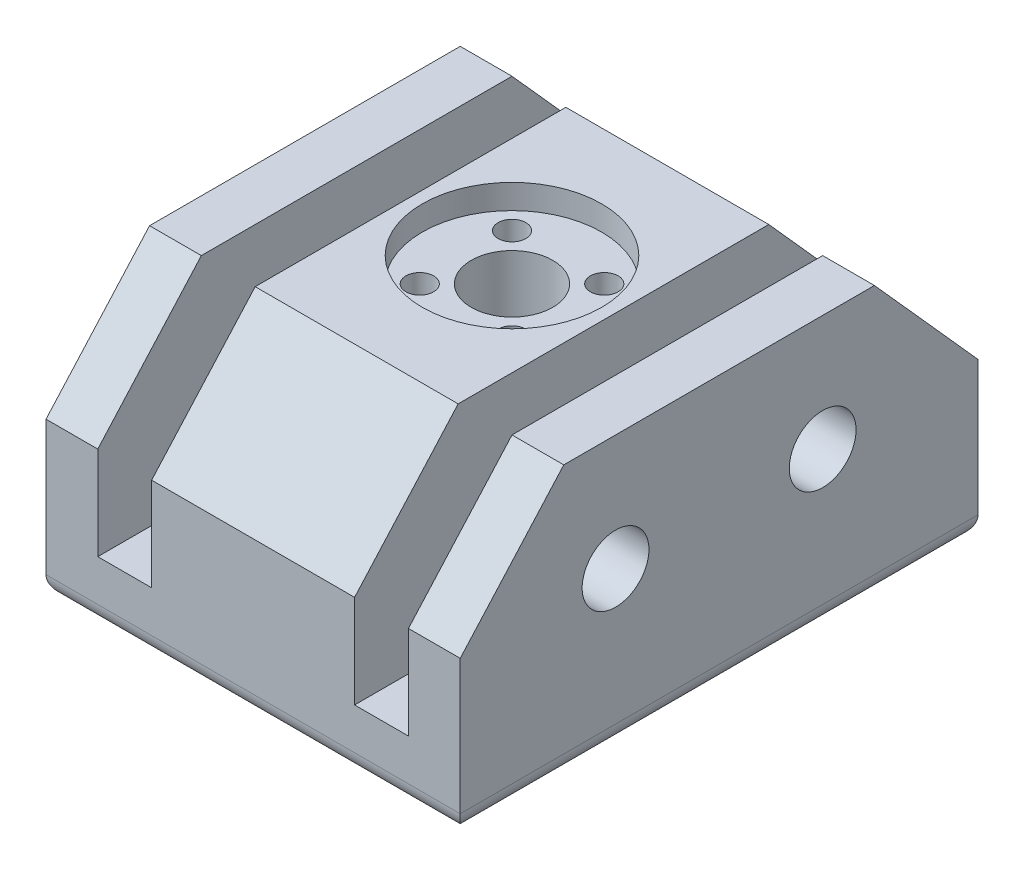
from build123d import *

# Parameters (mm, degrees)
SKETCH1_W           = 63.5
SKETCH1_H           = 6.35
BOSS_EXTRUDE1_DEPTH = 50.8
BOSS_EXTRUDE2_DEPTH = 50.8
SKETCH10_W          = 6.604
SKETCH10_H          = 25.629031657
CUT_EXTRUDE1_DEPTH  = 88.854357354
LPATTERN3_COUNT     = 2
LPATTERN3_PITCH     = 31.496
SKETCH11_R          = 4.09575
CUT_EXTRUDE2_DEPTH  = 88.854357354
FILLET1_R           = 2.54
CUT_EXTRUDE7_REACH  = 89.854
SKETCH21_R          = 1.700000029
SKETCH22_R          = 11
CUT_EXTRUDE8_DEPTH  = 3
SKETCH24_R          = 5
CUT_EXTRUDE10_DEPTH = 88.854357354
SKETCH28_R          = 3.125
CUT_EXTRUDE11_DEPTH = 5


with BuildPart() as part:
    # Sketch1 → Boss-Extrude1 (new body)
    with BuildSketch(Plane(origin=(0, 0, 0), x_dir=(0, 0, -1), z_dir=(1, 0, 0))):
        with Locations((31.75, 3.175)):
            Rectangle(SKETCH1_W, SKETCH1_H)
    extrude(amount=-BOSS_EXTRUDE1_DEPTH)

    # Sketch2 → Boss-Extrude2 (add)
    with BuildSketch(Plane(origin=(0, 0, 0), x_dir=(0, 0, -1), z_dir=(1, 0, 0))):
        Polygon((0, 6.35), (0, 19.05), (12.7, 33.249031657), (50.8, 33.249031657), (63.5, 19.05), (63.5, 6.35), align=None)
    extrude(amount=-BOSS_EXTRUDE2_DEPTH)

    # Sketch10 → Cut-Extrude1 (cut, through all)
    with BuildSketch(Plane(origin=(0, 0, -63.5), x_dir=(-1, 0, 0), z_dir=(0, 0, -1))):
        with Locations((9.652, 20.434515829)):
            Rectangle(SKETCH10_W, SKETCH10_H)
    cut_extrude1 = extrude(amount=-CUT_EXTRUDE1_DEPTH, mode=Mode.SUBTRACT)

    # LPattern3: Cut-Extrude1 ×2
    with Locations(*[(-i * LPATTERN3_PITCH, 0, 0) for i in range(1, LPATTERN3_COUNT)]):
        add(cut_extrude1, mode=Mode.SUBTRACT)

    # Sketch11 → Cut-Extrude2 (cut, through all)
    with BuildSketch(Plane(origin=(0, 0, 0), x_dir=(0, 0, -1), z_dir=(1, 0, 0))):
        with Locations((19.05, 19.05)):
            Circle(SKETCH11_R)
        with Locations((44.45, 19.05)):
            Circle(SKETCH11_R)
    extrude(amount=-CUT_EXTRUDE2_DEPTH, mode=Mode.SUBTRACT)

    # Fillet1
    fillet1_edges = [part.edges().sort_by_distance(p)[0] for p in [
        (0, 0, -31.75),
        (-50.8, 0, -31.75),
        (-25.4, 0, 0),
        (-25.4, 0, -63.5),
    ]]
    fillet(fillet1_edges, radius=FILLET1_R)

    # Sketch21 → Cut-Extrude7 (cut, up to next)
    with BuildSketch(Plane.XZ, mode=Mode.PRIVATE) as cut_extrude7_sk1:
        with Locations((-31.056854284, -37.406854215)):
            Circle(SKETCH21_R)
    cut_extrude7_tool1 = extrude(cut_extrude7_sk1.sketch, amount=-CUT_EXTRUDE7_REACH, mode=Mode.PRIVATE) & part.part
    # Sketch21 → Cut-Extrude7 (cut, up to next)
    with BuildSketch(Plane.XZ, mode=Mode.PRIVATE) as cut_extrude7_sk2:
        with Locations((-31.056854215, -26.093145716)):
            Circle(SKETCH21_R)
    cut_extrude7_tool2 = extrude(cut_extrude7_sk2.sketch, amount=-CUT_EXTRUDE7_REACH, mode=Mode.PRIVATE) & part.part
    # Sketch21 → Cut-Extrude7 (cut, up to next)
    with BuildSketch(Plane.XZ, mode=Mode.PRIVATE) as cut_extrude7_sk3:
        with Locations((-19.743145716, -26.093145785)):
            Circle(SKETCH21_R)
    cut_extrude7_tool3 = extrude(cut_extrude7_sk3.sketch, amount=-CUT_EXTRUDE7_REACH, mode=Mode.PRIVATE) & part.part
    # Sketch21 → Cut-Extrude7 (cut, up to next)
    with BuildSketch(Plane.XZ, mode=Mode.PRIVATE) as cut_extrude7_sk4:
        with Locations((-19.743145785, -37.406854284)):
            Circle(SKETCH21_R)
    cut_extrude7_tool4 = extrude(cut_extrude7_sk4.sketch, amount=-CUT_EXTRUDE7_REACH, mode=Mode.PRIVATE) & part.part
    add(cut_extrude7_tool1.solids().sort_by_distance((-31.056854, 0, -37.406854))[0], mode=Mode.SUBTRACT)
    add(cut_extrude7_tool2.solids().sort_by_distance((-31.056854, 0, -26.093146))[0], mode=Mode.SUBTRACT)
    add(cut_extrude7_tool3.solids().sort_by_distance((-19.743146, 0, -26.093146))[0], mode=Mode.SUBTRACT)
    add(cut_extrude7_tool4.solids().sort_by_distance((-19.743146, 0, -37.406854))[0], mode=Mode.SUBTRACT)

    # Sketch22 → Cut-Extrude8 (cut)
    with BuildSketch(Plane.XZ.offset(-33.249031657)):
        with Locations((-25.4, -31.75)):
            Circle(SKETCH22_R)
    extrude(amount=CUT_EXTRUDE8_DEPTH, mode=Mode.SUBTRACT)

    # Sketch24 → Cut-Extrude10 (cut, through all)
    with BuildSketch(Plane.XZ):
        with Locations((-25.4, -31.75)):
            Circle(SKETCH24_R)
    extrude(amount=-CUT_EXTRUDE10_DEPTH, mode=Mode.SUBTRACT)

    # Sketch28 → Cut-Extrude11 (cut)
    with BuildSketch(Plane.XZ):
        with Locations((-19.743145785, -37.406854284)):
            Circle(SKETCH28_R)
        with Locations((-31.056854284, -37.406854215)):
            Circle(SKETCH28_R)
        with Locations((-31.056854215, -26.093145716)):
            Circle(SKETCH28_R)
        with Locations((-19.743145716, -26.093145785)):
            Circle(SKETCH28_R)
    extrude(amount=-CUT_EXTRUDE11_DEPTH, mode=Mode.SUBTRACT)


solid = part.part
